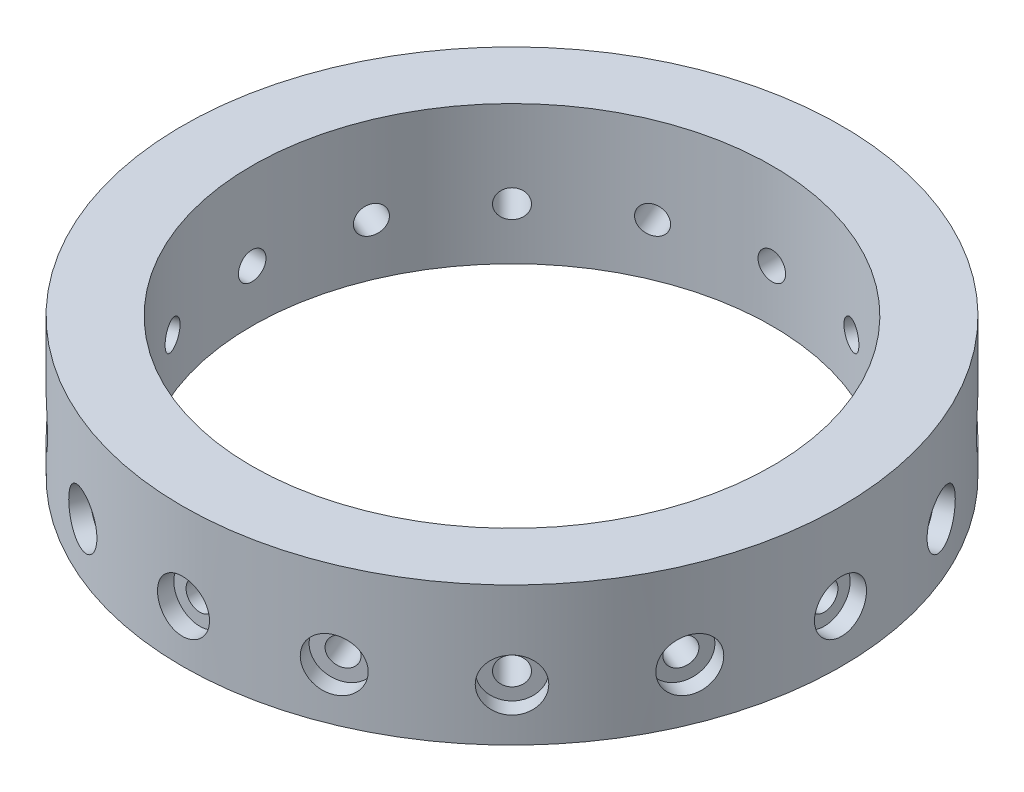
from build123d import *

# Parameters (mm, degrees)
SKETCH1_R                                        = 60.325
SKETCH1_R_2                                      = 47.625
BOSS_EXTRUDE1_DEPTH                              = 25.4
CBORE_FOR_1_4_SOCKET_HEAD_CAP_SCREW1_D           = 5.0546
CBORE_FOR_1_4_SOCKET_HEAD_CAP_SCREW1_CBORE_D     = 9.525
CBORE_FOR_1_4_SOCKET_HEAD_CAP_SCREW1_CBORE_DEPTH = 3.175
CIRPATTERN1_COUNT                                = 16


with BuildPart() as part:
    # Sketch1 → Boss-Extrude1 (new body)
    with BuildSketch(Plane(origin=(0, 0, 0), x_dir=(1, 0, 0), z_dir=(0, 1, 0))):
        Circle(SKETCH1_R)
        Circle(SKETCH1_R_2, mode=Mode.SUBTRACT)
    extrude(amount=BOSS_EXTRUDE1_DEPTH)

    # CBORE for 1/4 Socket Head Cap Screw1 (through all)
    with Locations(Plane(origin=(0, 0, -60.325), x_dir=(-1, 0, 0), z_dir=(0, 0, -1))):
        with Locations((0, 9.525)):
            cbore_for_1_4_socket_head_cap_screw1 = CounterBoreHole(CBORE_FOR_1_4_SOCKET_HEAD_CAP_SCREW1_D / 2, CBORE_FOR_1_4_SOCKET_HEAD_CAP_SCREW1_CBORE_D / 2, CBORE_FOR_1_4_SOCKET_HEAD_CAP_SCREW1_CBORE_DEPTH)

    # CirPattern1: CBORE for 1/4 Socket Head Cap Screw1 ×16 about axis
    cirpattern1_axis = Axis((0, 0, 0), (0, 1, 0))
    for i in range(1, CIRPATTERN1_COUNT):
        add(cbore_for_1_4_socket_head_cap_screw1.rotate(cirpattern1_axis, i * 360 / CIRPATTERN1_COUNT), mode=Mode.SUBTRACT)


solid = part.part
